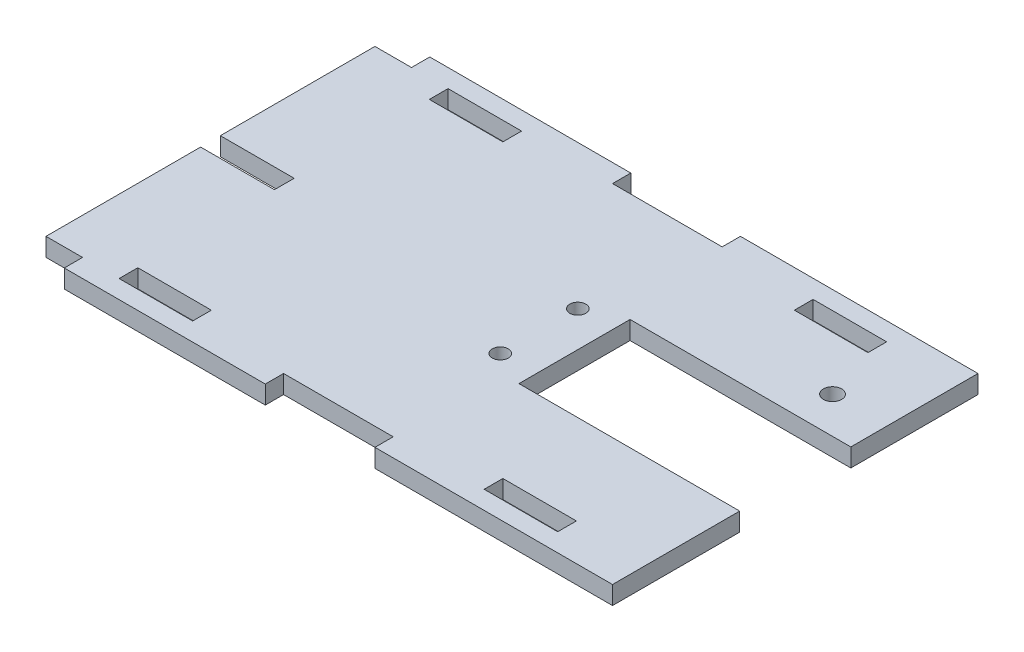
from build123d import *

# Parameters (mm, degrees)
BOSS_EXTRUDE1_DEPTH = 6.35
SKETCH4_W           = 25.5524
SKETCH4_H           = 6.5024
SKETCH4_W_2         = 12.7
SKETCH4_H_2         = 6.35
SKETCH4_W_3         = 38.1
CUT_EXTRUDE1_DEPTH  = 240.70724332
SKETCH5_R           = 3.175
CUT_EXTRUDE2_DEPTH  = 240.70724332
SKETCH6_R           = 2.778125
CUT_EXTRUDE3_DEPTH  = 240.70724332


with BuildPart() as part:
    # Sketch1 → Boss-Extrude1 (new body)
    with BuildSketch(Plane(origin=(0, 0, 0), x_dir=(1, 0, 0), z_dir=(0, 1, 0))):
        Polygon((0, 60.071), (0, 0), (203.2, 0), (203.2, 44.196), (126.492, 44.196), (126.492, 82.804), (203.2, 82.804), (203.2, 127), (0, 127), (0, 66.929), (25.654, 66.929), (25.654, 60.071), align=None)
    extrude(amount=BOSS_EXTRUDE1_DEPTH)

    # Sketch4 → Cut-Extrude1 (cut, through all)
    with BuildSketch(Plane(origin=(0, 6.35, 0), x_dir=(1, 0, 0), z_dir=(0, 1, 0))):
        with Locations((38.1762, 117.3988)):
            Rectangle(SKETCH4_W, SKETCH4_H)
        with Locations((165.0238, 117.3988)):
            Rectangle(SKETCH4_W, SKETCH4_H)
        with Locations((38.1762, 9.6012)):
            Rectangle(SKETCH4_W, SKETCH4_H)
        with Locations((165.0238, 9.6012)):
            Rectangle(SKETCH4_W, SKETCH4_H)
        with Locations((6.35, 123.825)):
            Rectangle(SKETCH4_W_2, SKETCH4_H_2)
        with Locations((6.35, 3.175)):
            Rectangle(SKETCH4_W_2, SKETCH4_H_2)
        with Locations((101.6, 3.175)):
            Rectangle(SKETCH4_W_3, SKETCH4_H_2)
        with Locations((101.6, 123.825)):
            Rectangle(SKETCH4_W_3, SKETCH4_H_2)
    extrude(amount=-CUT_EXTRUDE1_DEPTH, mode=Mode.SUBTRACT)

    # Sketch5 → Cut-Extrude2 (cut, through all)
    with BuildSketch(Plane(origin=(0, 6.35, 0), x_dir=(1, 0, 0), z_dir=(0, 1, 0))):
        with Locations((184.15, 95.504)):
            Circle(SKETCH5_R)
    extrude(amount=-CUT_EXTRUDE2_DEPTH, mode=Mode.SUBTRACT)

    # Sketch6 → Cut-Extrude3 (cut, through all)
    with BuildSketch(Plane.XZ):
        with Locations((114.173, -50.038)):
            Circle(SKETCH6_R)
        with Locations((114.173, -76.962)):
            Circle(SKETCH6_R)
    extrude(amount=-CUT_EXTRUDE3_DEPTH, mode=Mode.SUBTRACT)


solid = part.part
